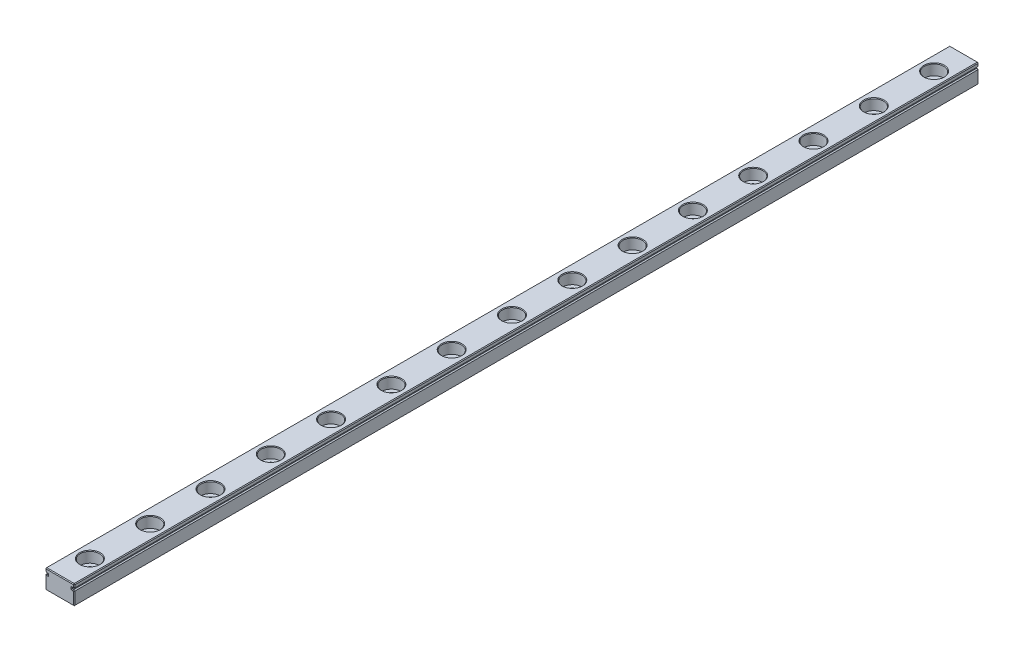
from build123d import *

# Parameters (mm, degrees)
BOSS_EXTRUDE1_DEPTH = 375
CHAMFER1_SIZE       = 0.3
LPATTERN1_COUNT     = 15
LPATTERN1_PITCH     = 25


with BuildPart() as part:
    # Sketch1 → Boss-Extrude1 (new body)
    with BuildSketch(Plane.XY):
        with BuildLine():
            Line((0, 8), (12, 8))
            Line((12, 8), (12, 6.75))
            Line((12, 6.75), (12, 6.559016994))
            ThreePointArc((12, 6.559016994), (11.706107374, 6.475528258), (11.5, 6.25))
            Line((11.5, 6.25), (11, 6.25))
            Line((11, 6.25), (11, 5.75))
            Line((11, 5.75), (11.5, 5.75))
            ThreePointArc((11.5, 5.75), (11.706107374, 5.524471742), (12, 5.440983006))
            Line((12, 5.440983006), (12, 5.25))
            Line((12, 5.25), (12, 0))
            Line((12, 0), (0, 0))
            Line((0, 0), (0, 5.25))
            Line((0, 5.25), (0, 5.440983006))
            ThreePointArc((0, 5.440983006), (0.293892626, 5.524471742), (0.5, 5.75))
            Line((0.5, 5.75), (1, 5.75))
            Line((1, 5.75), (1, 6.25))
            Line((1, 6.25), (0.5, 6.25))
            ThreePointArc((0.5, 6.25), (0.293892626, 6.475528258), (0, 6.559016994))
            Line((0, 6.559016994), (0, 6.75))
            Line((0, 6.75), (0, 8))
        make_face()
    extrude(amount=BOSS_EXTRUDE1_DEPTH)

    # Chamfer1
    chamfer1_edges = [part.edges().sort_by_distance(p)[0] for p in [
        (0, 0, 187.5),
        (12, 0, 187.5),
        (0, 8, 187.5),
        (12, 8, 187.5),
        (0.293892626, 5.524471742, 375),
        (0.75, 5.75, 375),
        (1, 6, 375),
        (0.75, 6.25, 375),
        (0.293892626, 6.475528258, 375),
        (0, 7.279508497, 375),
        (6, 8, 375),
        (12, 7.279508497, 375),
        (11.706107374, 6.475528258, 375),
        (11.25, 6.25, 375),
        (11, 6, 375),
        (11.25, 5.75, 375),
        (11.706107374, 5.524471742, 375),
        (12, 2.720491503, 375),
        (6, 0, 375),
        (0, 2.720491503, 375),
        (12, 2.720491503, 0),
        (11.706107374, 5.524471742, 0),
        (11.25, 5.75, 0),
        (11, 6, 0),
        (11.25, 6.25, 0),
        (11.706107374, 6.475528258, 0),
        (12, 7.279508497, 0),
        (6, 0, 0),
        (0, 2.720491503, 0),
        (0.293892626, 5.524471742, 0),
        (0.75, 5.75, 0),
        (1, 6, 0),
        (0.75, 6.25, 0),
        (0.293892626, 6.475528258, 0),
        (0, 7.279508497, 0),
        (6, 8, 0),
    ]]
    chamfer(chamfer1_edges, length=CHAMFER1_SIZE)

    # Sketch3 → CBORE for M5 Hex Head Bolt1 (revolve, cut)
    with BuildSketch(Plane(origin=(6, 8, 12.5), x_dir=(0, 0, 1), z_dir=(1, 0, 0))):
        Polygon((0, 0), (0, 8), (2.5, 8), (2.25, 7.75), (2.25, 4.5), (4, 4.5), (4, 0.25), (4.25, 0), align=None)
    cbore_for_m5_hex_head_bolt1 = revolve(axis=Axis((6, 14.35, 12.5), (0, -1, 0)), mode=Mode.SUBTRACT)

    # LPattern1: CBORE for M5 Hex Head Bolt1 ×15
    with Locations(*[(0, 0, i * LPATTERN1_PITCH) for i in range(1, LPATTERN1_COUNT)]):
        add(cbore_for_m5_hex_head_bolt1, mode=Mode.SUBTRACT)


solid = part.part
